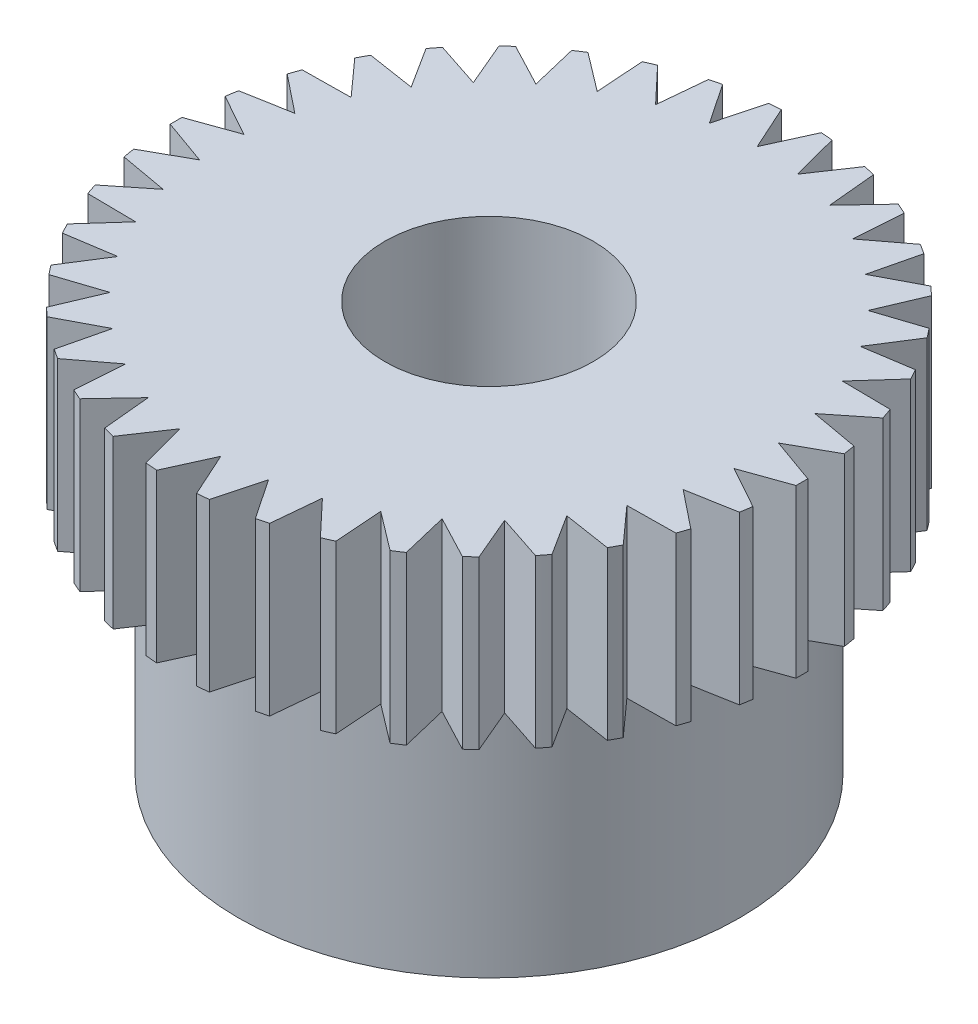
from build123d import *

# Parameters (mm, degrees)
SKETCH_1_R          = 6
EXTRUDE_1_DEPTH     = 5.8
SKETCH_2_R          = 7.5
EXTRUDE_2_DEPTH     = 4
CUT_EXTRUDE_3_DEPTH = 15.440914098
SKETCH_4_R          = 2.5
CUT_EXTRUDE_4_DEPTH = 15.43297622


with BuildPart() as part:
    # Эскиз1 → Вытянуть1 (new body)
    with BuildSketch(Plane(origin=(0, 0, 0), x_dir=(1, 0, 0), z_dir=(0, 1, 0))):
        Circle(SKETCH_1_R)
    extrude(amount=EXTRUDE_1_DEPTH)

    # Эскиз2 → Вытянуть2 (add)
    with BuildSketch(Plane(origin=(0, 5.8, 0), x_dir=(1, 0, 0), z_dir=(0, 1, 0))):
        Circle(SKETCH_2_R)
    extrude(amount=EXTRUDE_2_DEPTH)

    # Эскиз3 → Вытянуть3 (cut, through all)
    with BuildSketch(Plane(origin=(0, 9.8, 0), x_dir=(1, 0, 0), z_dir=(0, 1, 0))):
        Polygon((-0.62278932, 7.802539676), (0.62278932, 7.802539676), (0, 6.428342871), align=None)
        Polygon((0.669960535, 7.798630957), (1.898551107, 7.593615451), (1.058070461, 6.340668653), align=None)
        Polygon((1.944435614, 7.581995916), (3.122525368, 7.177557193), (2.087279518, 6.080037523), align=None)
        Polygon((3.165871558, 7.158543791), (4.261325277, 6.565713884), (3.059553031, 5.653558819), align=None)
        Polygon((4.300950779, 6.539825252), (5.283887341, 5.774775016), (3.948369913, 5.072865768), align=None)
        Polygon((5.318711274, 5.742717328), (6.162318733, 4.82631534), (4.729485556, 4.353798163), align=None)
        Polygon((6.19139119, 4.788963046), (6.872658133, 3.746206362), (5.381593163, 3.515970293), align=None)
        Polygon((6.895186095, 3.704578336), (7.395529336, 2.563910641), (5.886904936, 2.582235919), align=None)
        Polygon((7.410898297, 2.519142386), (7.716669776, 1.311678121), (6.231637289, 1.578064881), align=None)
        Polygon((7.724460512, 1.264990798), (7.827319581, 0.023666441), (6.406386821, 0.530848347), align=None)
        Polygon((7.827319581, -0.023666441), (7.724460512, -1.264990798), (6.406386821, -0.530848347), align=None)
        Polygon((7.716669776, -1.311678121), (7.410898297, -2.519142386), (6.231637289, -1.578064881), align=None)
        Polygon((7.395529336, -2.563910641), (6.895186095, -3.704578336), (5.886904936, -2.582235919), align=None)
        Polygon((6.872658133, -3.746206362), (6.19139119, -4.788963046), (5.381593163, -3.515970293), align=None)
        Polygon((6.162318733, -4.82631534), (5.318711274, -5.742717328), (4.729485556, -4.353798163), align=None)
        Polygon((5.283887341, -5.774775016), (4.300950779, -6.539825252), (3.948369913, -5.072865768), align=None)
        Polygon((4.261325277, -6.565713884), (3.165871558, -7.158543791), (3.059553031, -5.653558819), align=None)
        Polygon((3.122525368, -7.177557193), (1.944435614, -7.581995916), (2.087279518, -6.080037523), align=None)
        Polygon((1.898551107, -7.593615451), (0.669960535, -7.798630957), (1.058070461, -6.340668653), align=None)
        Polygon((0.62278932, -7.802539676), (-0.62278932, -7.802539676), (0, -6.428342871), align=None)
        Polygon((-0.669960535, -7.798630957), (-1.898551107, -7.593615451), (-1.058070461, -6.340668653), align=None)
        Polygon((-1.944435614, -7.581995916), (-3.122525368, -7.177557193), (-2.087279518, -6.080037523), align=None)
        Polygon((-3.165871558, -7.158543791), (-4.261325277, -6.565713884), (-3.059553031, -5.653558819), align=None)
        Polygon((-4.300950779, -6.539825252), (-5.283887341, -5.774775016), (-3.948369913, -5.072865768), align=None)
        Polygon((-5.318711274, -5.742717328), (-6.162318733, -4.82631534), (-4.729485556, -4.353798163), align=None)
        Polygon((-6.19139119, -4.788963046), (-6.872658133, -3.746206362), (-5.381593163, -3.515970293), align=None)
        Polygon((-6.895186095, -3.704578336), (-7.395529336, -2.563910641), (-5.886904936, -2.582235919), align=None)
        Polygon((-7.410898297, -2.519142386), (-7.716669776, -1.311678121), (-6.231637289, -1.578064881), align=None)
        Polygon((-7.724460512, -1.264990798), (-7.827319581, -0.023666441), (-6.406386821, -0.530848347), align=None)
        Polygon((-7.827319581, 0.023666441), (-7.724460512, 1.264990798), (-6.406386821, 0.530848347), align=None)
        Polygon((-7.716669776, 1.311678121), (-7.410898297, 2.519142386), (-6.231637289, 1.578064881), align=None)
        Polygon((-7.395529336, 2.563910641), (-6.895186095, 3.704578336), (-5.886904936, 2.582235919), align=None)
        Polygon((-6.872658133, 3.746206362), (-6.19139119, 4.788963046), (-5.381593163, 3.515970293), align=None)
        Polygon((-6.162318733, 4.82631534), (-5.318711274, 5.742717328), (-4.729485556, 4.353798163), align=None)
        Polygon((-5.283887341, 5.774775016), (-4.300950779, 6.539825252), (-3.948369913, 5.072865768), align=None)
        Polygon((-4.261325277, 6.565713884), (-3.165871558, 7.158543791), (-3.059553031, 5.653558819), align=None)
        Polygon((-3.122525368, 7.177557193), (-1.944435614, 7.581995916), (-2.087279518, 6.080037523), align=None)
        Polygon((-1.898551107, 7.593615451), (-0.669960535, 7.798630957), (-1.058070461, 6.340668653), align=None)
    extrude(amount=-CUT_EXTRUDE_3_DEPTH, mode=Mode.SUBTRACT)

    # Эскиз4 → Вытянуть4 (cut, through all)
    with BuildSketch(Plane.XZ):
        Circle(SKETCH_4_R)
    extrude(amount=-CUT_EXTRUDE_4_DEPTH, mode=Mode.SUBTRACT)


solid = part.part
